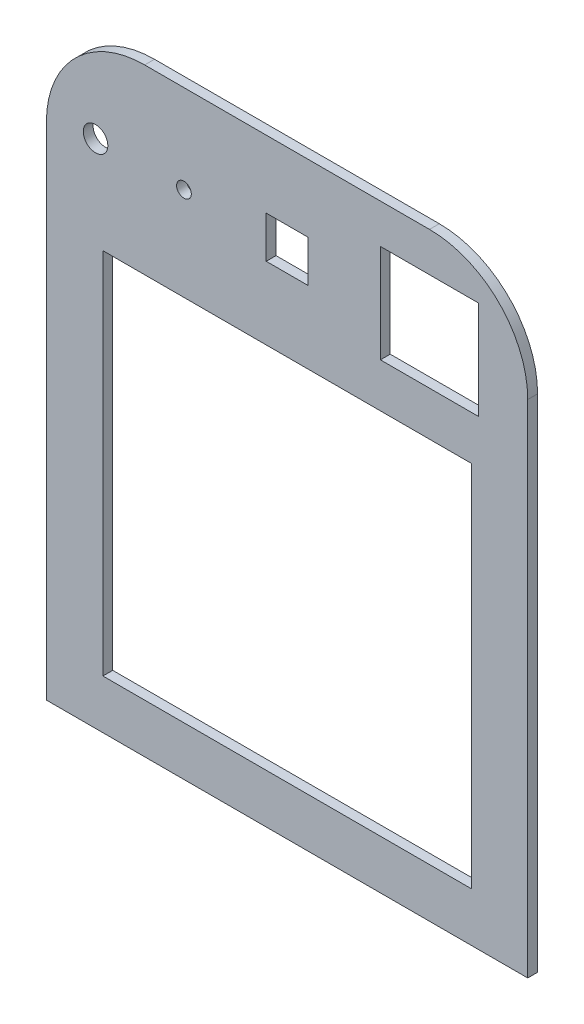
from build123d import *

# Parameters (mm, degrees)
SKETCH_1_W          = 98
SKETCH_1_H          = 122
EXTRUDE_1_DEPTH     = 2
SKETCH_2_R          = 1.5
SKETCH_2_R_2        = 2.5
SKETCH_2_W          = 75
SKETCH_2_H          = 75
SKETCH_2_W_2        = 8.5
SKETCH_2_H_2        = 8.5
SKETCH_2_W_3        = 20
SKETCH_2_H_3        = 20
CUT_EXTRUDE_1_DEPTH = 3
FILLET_3_R          = 20
FILLET_5_R          = 20


with BuildPart() as part:
    # 草图1 → 凸台-拉伸1 (new body)
    with BuildSketch(Plane.XY):
        Rectangle(SKETCH_1_W, SKETCH_1_H)
    extrude(amount=EXTRUDE_1_DEPTH)

    # 草图2 → 切除-拉伸1 (cut)
    with BuildSketch(Plane.XY.offset(2)):
        with Locations((-21, 43)):
            Circle(SKETCH_2_R)
        with Locations((-39, 43)):
            Circle(SKETCH_2_R_2)
        with Locations((0, -13.5)):
            Rectangle(SKETCH_2_W, SKETCH_2_H)
        with Locations((0, 43)):
            Rectangle(SKETCH_2_W_2, SKETCH_2_H_2)
        with Locations((29, 43)):
            Rectangle(SKETCH_2_W_3, SKETCH_2_H_3)
    extrude(amount=-CUT_EXTRUDE_1_DEPTH, mode=Mode.SUBTRACT)

    # 圆角3
    fillet_3_edges = [part.edges().sort_by_distance(p)[0] for p in [
        (49, 61, 1),
    ]]
    fillet(fillet_3_edges, radius=FILLET_3_R)

    # 圆角5
    fillet_5_edges = [part.edges().sort_by_distance(p)[0] for p in [
        (-49, 61, 1),
    ]]
    fillet(fillet_5_edges, radius=FILLET_5_R)


solid = part.part
